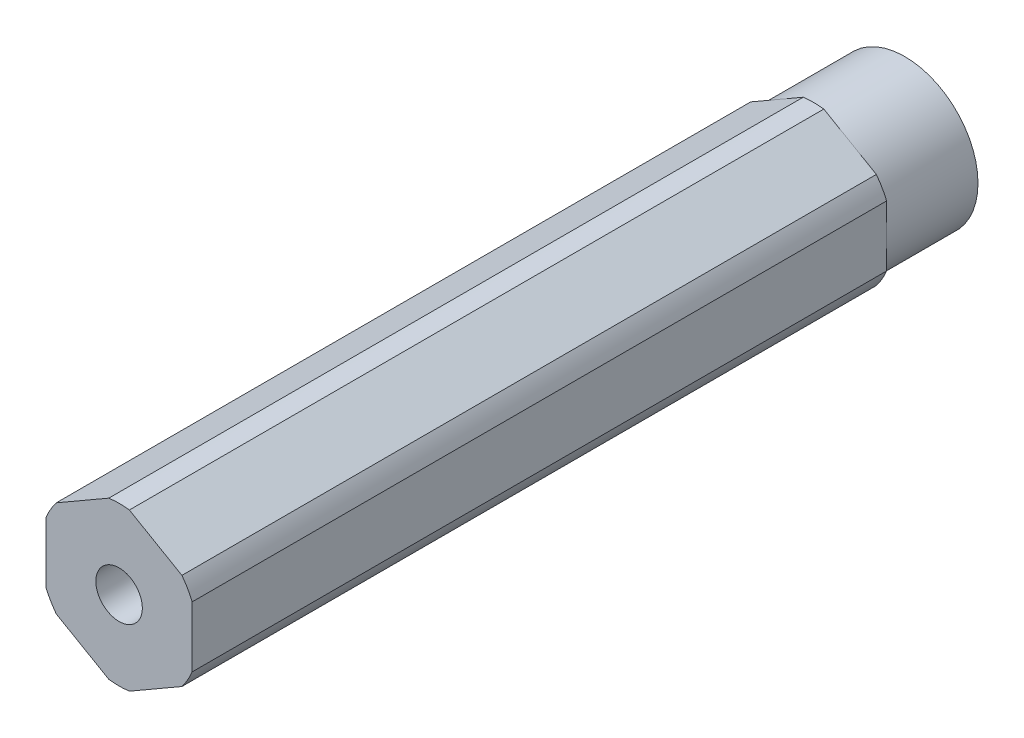
from build123d import *

# Parameters (mm, degrees)
BOSS_EXTRUDE1_DEPTH = 34.13125
SKETCH3_R           = 2.0193
CUT_EXTRUDE1_DEPTH  = 69.901066982
CUT_EXTRUDE3_START  = -7.9375
SKETCH8_R           = 6.875
SKETCH8_R_2         = 6.35
CUT_EXTRUDE3_DEPTH  = 7.9375


with BuildPart() as part:
    # Sketch1 → Boss-Extrude1 (new, symmetric)
    with BuildSketch(Plane.XY):
        with BuildLine():
            Line((-0.893039494, 6.816751826), (-5.456960506, 4.181770802))
            ThreePointArc((-5.456960506, 4.181770802), (-5.953924651, 3.4375), (-6.35, 2.634981025))
            Line((-6.35, 2.634981025), (-6.35, -2.634981025))
            ThreePointArc((-6.35, -2.634981025), (-5.953924651, -3.4375), (-5.456960506, -4.181770802))
            Line((-5.456960506, -4.181770802), (-0.893039494, -6.816751826))
            ThreePointArc((-0.893039494, -6.816751826), (0, -6.875), (0.893039494, -6.816751826))
            Line((0.893039494, -6.816751826), (5.456960506, -4.181770802))
            ThreePointArc((5.456960506, -4.181770802), (5.953924651, -3.4375), (6.35, -2.634981025))
            Line((6.35, -2.634981025), (6.35, 2.634981025))
            ThreePointArc((6.35, 2.634981025), (5.953924651, 3.4375), (5.456960506, 4.181770802))
            Line((5.456960506, 4.181770802), (0.893039494, 6.816751826))
            ThreePointArc((0.893039494, 6.816751826), (0, 6.875), (-0.893039494, 6.816751826))
        make_face()
    extrude(amount=BOSS_EXTRUDE1_DEPTH, both=True)

    # Sketch3 → Cut-Extrude1 (cut, through all)
    with BuildSketch(Plane.XY.offset(34.13125)):
        Circle(SKETCH3_R)
    extrude(amount=-CUT_EXTRUDE1_DEPTH, mode=Mode.SUBTRACT)

    # Sketch8 → Cut-Extrude3 (cut)
    with BuildSketch(Plane(origin=(0, 0, -34.13125), x_dir=(-1, 0, 0), z_dir=(0, 0, -1)).offset(CUT_EXTRUDE3_START)):
        Circle(SKETCH8_R)
        Circle(SKETCH8_R_2, mode=Mode.SUBTRACT)
    extrude(amount=CUT_EXTRUDE3_DEPTH, mode=Mode.SUBTRACT)


solid = part.part
